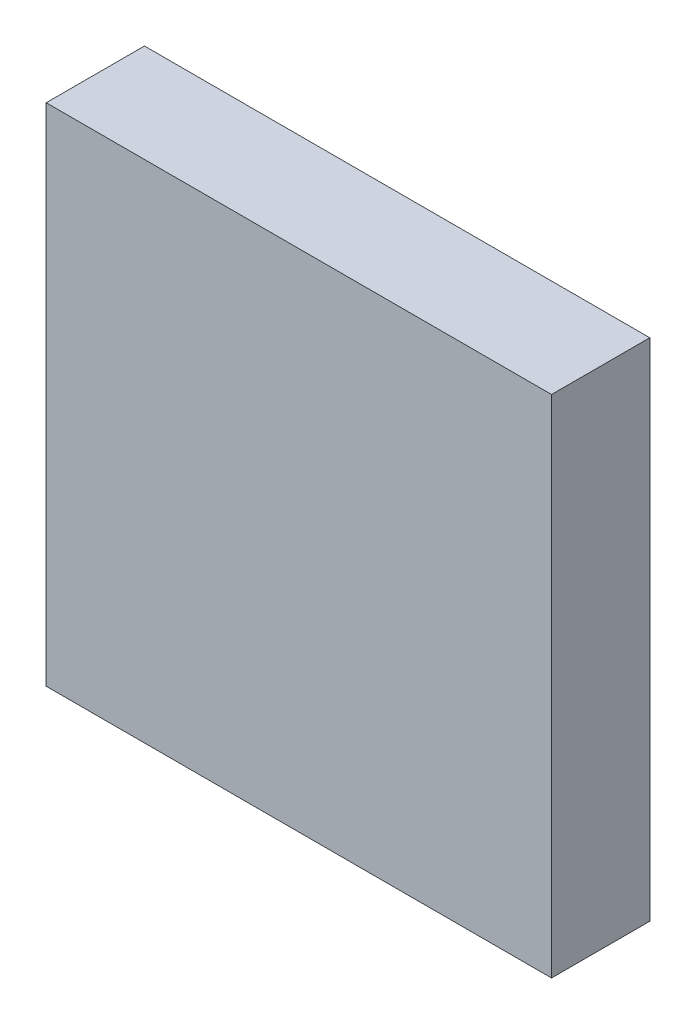
from build123d import *

# Parameters (mm, degrees)
SKETCH1_W               = 36
SKETCH1_H               = 36
SKETCH1_R               = 2.15
BOSS_EXTRUDE1_DEPTH     = 3
BOSS_EXTRUDE2_START     = 2
BOSS_EXTRUDE2_OUTLINE_W = 36
BOSS_EXTRUDE2_OUTLINE_H = 36
BOSS_EXTRUDE2_DEPTH     = 2


# Read off the part's stored shape, not the designer's step: Boss-Extrude2
with BuildPart() as part:
    # Sketch1 → Boss-Extrude1 (new, symmetric)
    with BuildSketch(Plane.XY):
        Rectangle(SKETCH1_W, SKETCH1_H)
        with Locations((-15.5, 15.5)):
            Circle(SKETCH1_R, mode=Mode.SUBTRACT)
        with Locations((15.5, 15.5)):
            Circle(SKETCH1_R, mode=Mode.SUBTRACT)
        with Locations((15.5, -15.5)):
            Circle(SKETCH1_R, mode=Mode.SUBTRACT)
        with Locations((-15.5, -15.5)):
            Circle(SKETCH1_R, mode=Mode.SUBTRACT)
    extrude(amount=BOSS_EXTRUDE1_DEPTH, both=True)

    # Boss-Extrude2 outline → Boss-Extrude2 (add)
    with BuildSketch(Plane.XY.offset(BOSS_EXTRUDE2_START)):
        Rectangle(BOSS_EXTRUDE2_OUTLINE_W, BOSS_EXTRUDE2_OUTLINE_H)
    extrude(amount=BOSS_EXTRUDE2_DEPTH)


solid = part.part
